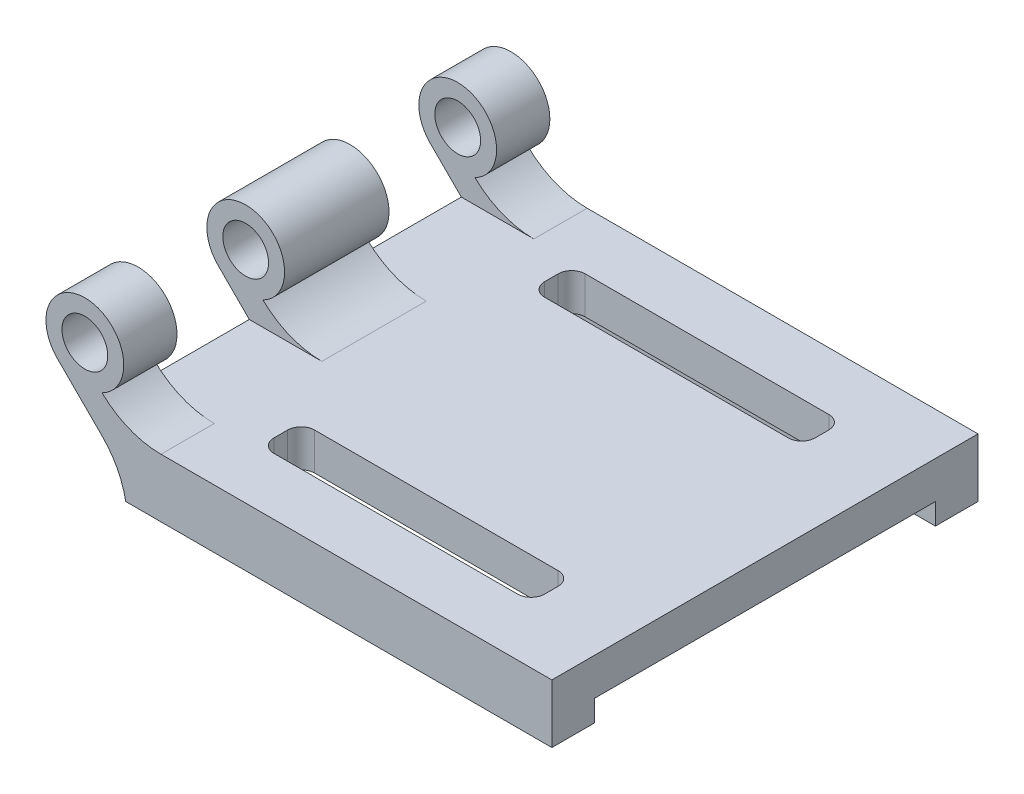
from build123d import *

# Parameters (mm, degrees)
SKETCH_1_R               = 2.15
EXTRUDE_1_DEPTH          = 40
CUT_EXTRUDE_2_DEPTH      = 58.739891142
CUT_EXTRUDE_2_DEPTH_BACK = 10
SKETCH_2_W               = 10.1
SKETCH_2_H               = 10
SKETCH_4_W               = 40
SKETCH_4_H               = 4
EXTRUDE_2_DEPTH          = 2
CUT_EXTRUDE_3_DEPTH      = 3.5
FILLET_1_R               = 8


with BuildPart() as part:
    # 草图1 → 凸台-拉伸1 (new body)
    with BuildSketch(Plane.XY):
        with BuildLine():
            Line((-20, 1.75), (-22.225540425, 3.975540425))
            ThreePointArc((-22.225540425, 3.975540425), (-23.242576583, 10.851086981), (-26.419060249, 4.669060249))
            Line((-26.419060249, 4.669060249), (-20, -1.75))
            Line((-20, -1.75), (20, -1.75))
            Line((20, -1.75), (20, 1.75))
            Line((20, 1.75), (-20, 1.75))
        make_face()
        with Locations((-23.838120497, 7.25)):
            Circle(SKETCH_1_R, mode=Mode.SUBTRACT)
    extrude(amount=EXTRUDE_1_DEPTH)

    # 草图2 → 切除-拉伸2 (cut, two sides: drawn at the far end of the back side and taken through both)
    with BuildSketch(Plane(origin=(-20.188120497, 0, 0), x_dir=(0, 0, -1), z_dir=(1, 0, 0)).offset(-CUT_EXTRUDE_2_DEPTH_BACK)):
        with Locations((-29.95, 6.75)):
            Rectangle(SKETCH_2_W, SKETCH_2_H)
        with Locations((-10.05, 6.75)):
            Rectangle(SKETCH_2_W, SKETCH_2_H)
    extrude(amount=CUT_EXTRUDE_2_DEPTH + CUT_EXTRUDE_2_DEPTH_BACK, mode=Mode.SUBTRACT)

    # 草图4 → 凸台-拉伸2 (add)
    with BuildSketch(Plane.XZ.offset(1.75)):
        with Locations((0, 2)):
            Rectangle(SKETCH_4_W, SKETCH_4_H)
        with Locations((0, 38)):
            Rectangle(SKETCH_4_W, SKETCH_4_H)
    extrude(amount=EXTRUDE_2_DEPTH)

    # 草图5 → 切除-拉伸3 (cut)
    with BuildSketch(Plane(origin=(0, 1.75, 0), x_dir=(1, 0, 0), z_dir=(0, 1, 0))):
        with BuildLine():
            Line((11.414328277, -30.822898901), (-11.445671723, -30.822898901))
            ThreePointArc((-11.445671723, -30.822898901), (-12.343697335, -31.194873288), (-12.715671723, -32.092898901))
            Line((-12.715671723, -32.092898901), (-12.715671723, -33.362898901))
            ThreePointArc((-12.715671723, -33.362898901), (-12.343697335, -34.260924513), (-11.445671723, -34.632898901))
            Line((-11.445671723, -34.632898901), (11.414328277, -34.632898901))
            ThreePointArc((11.414328277, -34.632898901), (12.31235389, -34.260924513), (12.684328277, -33.362898901))
            Line((12.684328277, -33.362898901), (12.684328277, -32.092898901))
            ThreePointArc((12.684328277, -32.092898901), (12.31235389, -31.194873288), (11.414328277, -30.822898901))
        make_face()
        with BuildLine():
            Line((12.684328277, -7.962898901), (12.684328277, -6.692898901))
            ThreePointArc((12.684328277, -6.692898901), (12.31235389, -5.794873288), (11.414328277, -5.422898901))
            Line((11.414328277, -5.422898901), (-11.445671723, -5.422898901))
            ThreePointArc((-11.445671723, -5.422898901), (-12.343697335, -5.794873288), (-12.715671723, -6.692898901))
            Line((-12.715671723, -6.692898901), (-12.715671723, -7.962898901))
            ThreePointArc((-12.715671723, -7.962898901), (-12.343697335, -8.860924513), (-11.445671723, -9.232898901))
            Line((-11.445671723, -9.232898901), (11.414328277, -9.232898901))
            ThreePointArc((11.414328277, -9.232898901), (12.31235389, -8.860924513), (12.684328277, -7.962898901))
        make_face()
    extrude(amount=-CUT_EXTRUDE_3_DEPTH, mode=Mode.SUBTRACT)

    # 圆角1
    # the kernel refuses this fillet: 8 mm, written as the material it adds along each edge
    with BuildSketch(Plane(origin=(-20, -1.75, 0), x_dir=(-0.707106781186549, 0.7071067811865461, 0), z_dir=(0, 0, 1)), Plane(origin=(-20, -1.75, 36), x_dir=(-0.707106781186549, 0.7071067811865461, 0), z_dir=(0, 0, 1))) as fillet_1_piece_1:
        with BuildLine():
            CenterArc((3.127528064, 8), FILLET_1_R, 235.408772886, 34.591227114)
            Line((-1.414213562, 1.414213562), (0, 0))
            Line((0, 0), (3.127528064, 0))
        make_face()
    extrude(amount=4)
    with BuildSketch(Plane(origin=(-20, 1.75, 0), x_dir=(-0.7071067811865483, 0.7071067811865467, 0), z_dir=(0, 0, 1))) as fillet_1_piece_2:
        with BuildLine():
            CenterArc((3.31547448, -7.998234019), FILLET_1_R, 91.203908923, 43.796091077)
            Line((-2.34137977, -2.34137977), (0, 0))
            Line((0, 0), (3.147389452, 0))
        make_face()
    extrude(amount=5)
    with BuildSketch(Plane(origin=(-20, 1.75, 15.1), x_dir=(1, 0, 0), z_dir=(0, 0, 1))) as fillet_1_piece_3:
        with BuildLine():
            CenterArc((3.311211025, 8), FILLET_1_R, 226.203908923, 43.796091077)
            Line((-2.225540425, 2.225540425), (0, 0))
            Line((0, 0), (3.311211025, 0))
        make_face()
    extrude(amount=9.8)
    with BuildSketch(Plane(origin=(-20, 1.75, 35), x_dir=(1, 0, 0), z_dir=(0, 0, 1))) as fillet_1_piece_4:
        with BuildLine():
            CenterArc((3.311211025, 8), FILLET_1_R, 226.203908923, 43.796091077)
            Line((-2.225540425, 2.225540425), (0, 0))
            Line((0, 0), (3.311211025, 0))
        make_face()
    extrude(amount=5)


solid = part.part
